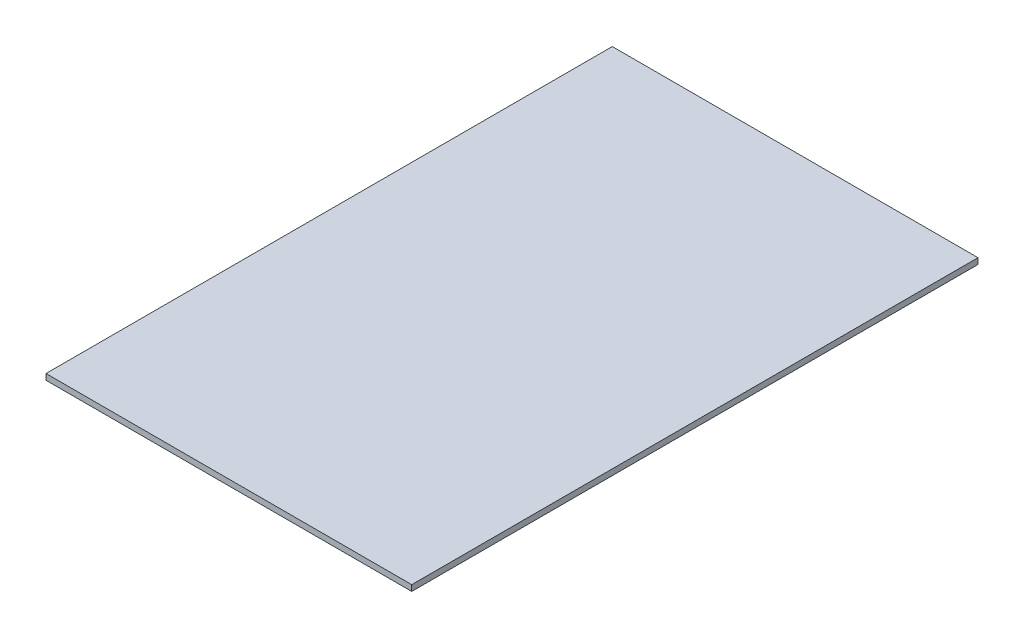
from build123d import *

# Parameters (mm, degrees)
SKETCH1_W           = 196.85
SKETCH1_H           = 304.8
BOSS_EXTRUDE1_DEPTH = 3.175


with BuildPart() as part:
    # Sketch1 → Boss-Extrude1 (new body)
    with BuildSketch(Plane(origin=(0, 0, 0), x_dir=(1, 0, 0), z_dir=(0, 1, 0))):
        with Locations((98.425, 152.4)):
            Rectangle(SKETCH1_W, SKETCH1_H)
    extrude(amount=BOSS_EXTRUDE1_DEPTH)


solid = part.part
